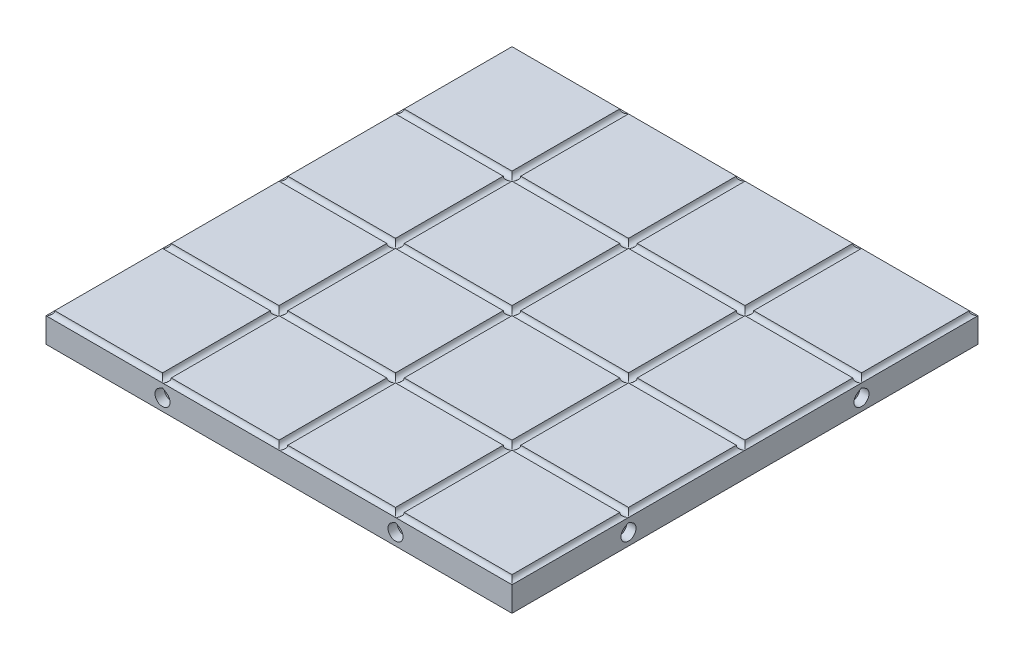
from build123d import *

# Parameters (mm, degrees)
SKETCH_1_W                  = 160
SKETCH_1_H                  = 160
EXTRUDE_1_DEPTH             = 10
SWEEP_1_PROFILE_R           = 1.5
PATTERN_LINEAR_1_COUNT      = 5
PATTERN_LINEAR_1_PITCH      = 40
SWEEP_2_PROFILE_R           = 1.5
PATTERN_LINEAR_2_COUNT      = 5
PATTERN_LINEAR_2_PITCH      = 40
PATTERN_LINEAR_2_COUNT_DIR2 = 5
PATTERN_LINEAR_2_PITCH_DIR2 = 40
SKETCH_181_R                = 2.575
CUT_EXTRUDE_1_DEPTH         = 3.15
PATTERN_CIRCULAR_1_COUNT    = 4
F_1_THE_OTHER_WAY_COUNT     = 4


with BuildPart() as part:
    # Эскиз1 → Бобышка-Вытянуть1 (new body)
    with BuildSketch(Plane(origin=(0, 0, 0), x_dir=(1, 0, 0), z_dir=(0, 1, 0))):
        Rectangle(SKETCH_1_W, SKETCH_1_H)
    extrude(amount=-EXTRUDE_1_DEPTH)

    # Вырез-По траектории1: sweep along a path in Эскиз2
    with BuildLine(Plane(origin=(0, 0, 0), x_dir=(1, 0, 0), z_dir=(0, 1, 0))) as sweep_1_path:
        Line((-80, 80), (-80, -80))
    # Вырез-По траектории1 profile (on start of the path) → Вырез-По траектории1 (sweep, cut)
    with BuildSketch(Plane(origin=(-80, 0, -80), x_dir=(1, 0, 0), z_dir=(0, 0, 1))):
        Circle(SWEEP_1_PROFILE_R)
    sweep_1 = sweep(path=sweep_1_path.line, mode=Mode.SUBTRACT)

    # Линейный массив1: Вырез-По траектории1 ×5
    with Locations(*[(i * PATTERN_LINEAR_1_PITCH, 0, 0) for i in range(1, PATTERN_LINEAR_1_COUNT)]):
        add(sweep_1, mode=Mode.SUBTRACT)

    # Вырез-По траектории2: sweep along a path in Эскиз180
    with BuildLine(Plane(origin=(0, 0, 0), x_dir=(1, 0, 0), z_dir=(0, 1, 0))) as sweep_2_path:
        Line((-80, -80), (80, -80))
    # Вырез-По траектории2 profile (on start of the path) → Вырез-По траектории2 (sweep, cut)
    with BuildSketch(Plane(origin=(-80, 0, 80), x_dir=(0, 0, 1), z_dir=(1, 0, 0))):
        Circle(SWEEP_2_PROFILE_R)
    sweep_2 = sweep(path=sweep_2_path.line, mode=Mode.SUBTRACT)

    # Линейный массив2: Sweep 2 5 × 5
    with Locations(*[(i * PATTERN_LINEAR_2_PITCH, 0, -j * PATTERN_LINEAR_2_PITCH_DIR2) for i in range(PATTERN_LINEAR_2_COUNT) for j in range(PATTERN_LINEAR_2_COUNT_DIR2) if (i, j) != (0, 0)]):
        add(sweep_2, mode=Mode.SUBTRACT)

    # Эскиз181 → Вырез-Вытянуть1 (cut)
    with BuildSketch(Plane.XY.offset(80)):
        with Locations((-40, -5.949176943)):
            Circle(SKETCH_181_R)
        with BuildLine():
            Line((-38.7125, -3.719161528), (-40, -2.975823057))
            Line((-40, -2.975823057), (-41.2875, -3.719161528))
            ThreePointArc((-41.2875, -3.719161528), (-40, -3.374176943), (-38.7125, -3.719161528))
        make_face()
        with Locations((40, -5.949176943)):
            Circle(SKETCH_181_R)
        with BuildLine():
            Line((41.2875, -3.719161528), (40, -2.975823057))
            Line((40, -2.975823057), (38.7125, -3.719161528))
            ThreePointArc((38.7125, -3.719161528), (40, -3.374176943), (41.2875, -3.719161528))
        make_face()
    cut_extrude_1 = extrude(amount=-CUT_EXTRUDE_1_DEPTH, mode=Mode.SUBTRACT)

    # Круговой массив1: Вырез-Вытянуть1 ×4 about axis
    pattern_circular_1_axis = Axis((0, -10, 0), (0, -1, 0))
    for i in range(1, PATTERN_CIRCULAR_1_COUNT):
        add(cut_extrude_1.rotate(pattern_circular_1_axis, i * 360 / PATTERN_CIRCULAR_1_COUNT), mode=Mode.SUBTRACT)

    # 1 the other way: Вырез-Вытянуть1 ×4 about axis
    f_1_the_other_way_axis = Axis((0, -10, 0), (0, 1, 0))
    for i in range(1, F_1_THE_OTHER_WAY_COUNT):
        add(cut_extrude_1.rotate(f_1_the_other_way_axis, i * 360 / F_1_THE_OTHER_WAY_COUNT), mode=Mode.SUBTRACT)


solid = part.part
